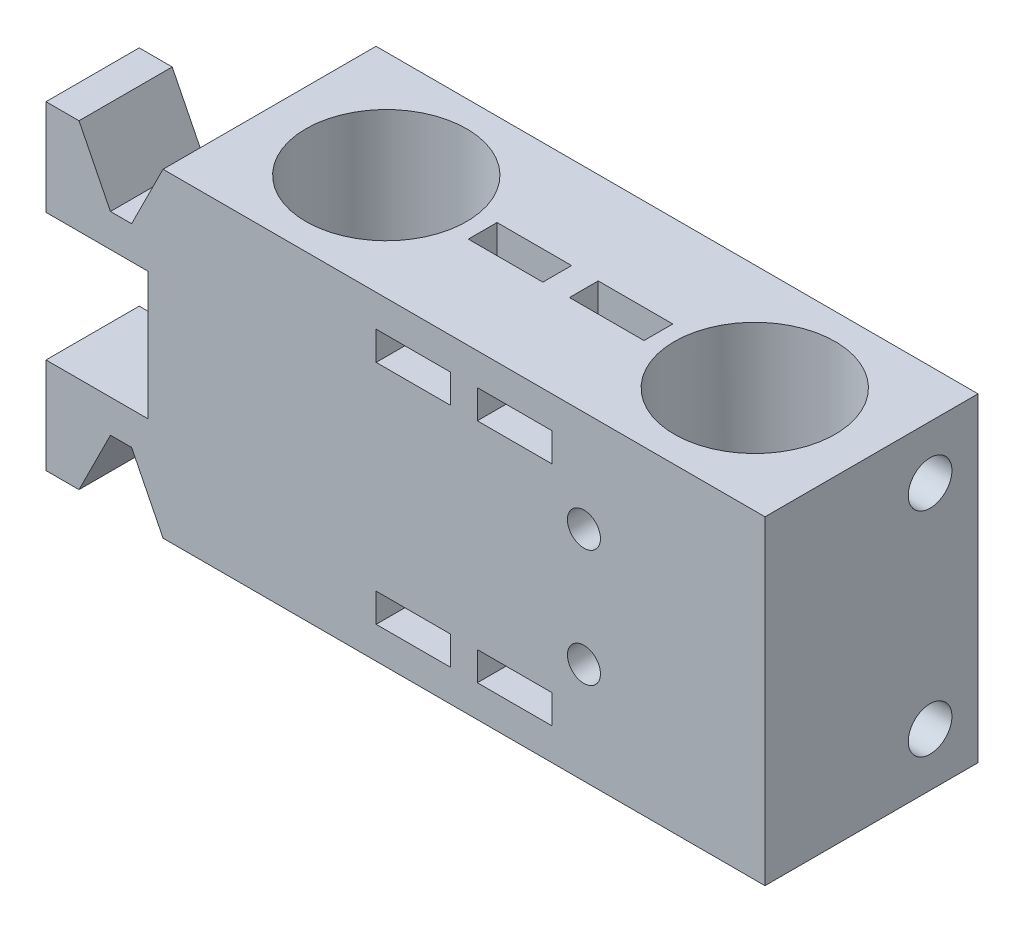
from build123d import *

# Parameters (mm, degrees)
BOSS_EXTRUDE1_DEPTH                     = 20
EARKNOTCH_SKETCH2_W                     = 10.99
EARKNOTCH_SKETCH2_H                     = 30
EARKNOTCH_CUT_EXTRUDE1_DEPTH            = 11.25
TOPHOLES_SKETCH3_R                      = 2.05
TOPHOLES_CUT_EXTRUDE2_DEPTH             = 4
FRONTHOLES_SKETCH1_R                    = 2.05
FRONTHOLES_CUT_EXTRUDE1_DEPTH           = 7
REARRIBBONHOLES_SKETCH2_W               = 7
REARRIBBONHOLES_SKETCH2_H               = 2.7
REARRIBBONHOLES_CUT_EXTRUDE1_DEPTH      = 11.35
RIGHTRIBBONHOLES_SKETCH4_W              = 7
RIGHTRIBBONHOLES_SKETCH4_H              = 2.7
RIGHTRIBBONHOLES_CUT_EXTRUDE2_DEPTH     = 5.7
LEFTRIBBONHOLES_SKETCH3_W               = 7
LEFTRIBBONHOLES_SKETCH3_H               = 2.7
LEFTRIBBONHOLES_CUT_EXTRUDE2_DEPTH      = 5.7
BOTTOMCLAMPMOUNTINGHOLESSKETCH3_R       = 2.05
BOTTOMCLAMPMOUNTHOLESCUT_EXTRUDE1_DEPTH = 4
LM8UUHOLESSKETCH1_R                     = 7.55
LM8UUCUT_EXTRUDE1_DEPTH                 = 77.534959986
RIBBONHOLEFILLET2_R                     = 2.7
RIBBONHOLEFILLET1_R                     = 2.7
RIBBONHOLEFILLET3_R                     = 2.7
RIBBONHOLEFILLET4_R                     = 2.7
PROBEMOUNTINGHOLESSKETCH1_R             = 1.55
PROBEMOUNTINGHOLESCUT_EXTRUDE1_DEPTH    = 3.1
LM8UUFASTENINGHOLESKETCH1_R             = 2.1
LM8UUFASTENINGHOLECUT_EXTRUDE1_DEPTH    = 14


with BuildPart() as part:
    # BackFace-Sketch1 → Boss-Extrude1 (new body)
    with BuildSketch(Plane.XY):
        Polygon((0, 0), (0, 9), (9.6, 9), (9.6, 21), (0, 21), (0, 30), (3.1, 30), (6.05, 24.095975949), (8.04, 24.095975949), (10.99, 30), (67.51, 30), (67.51, 0), (10.99, 0), (8.04, 5.904024051), (6.05, 5.904024051), (3.1, 0), align=None)
    extrude(amount=BOSS_EXTRUDE1_DEPTH)

    # EarKnotch-Sketch2 → EarKnotch-Cut-Extrude1 (cut)
    with BuildSketch(Plane(origin=(0, 0, 0), x_dir=(-1, 0, 0), z_dir=(0, 0, -1))):
        with Locations((-5.495, 15)):
            Rectangle(EARKNOTCH_SKETCH2_W, EARKNOTCH_SKETCH2_H)
    extrude(amount=-EARKNOTCH_CUT_EXTRUDE1_DEPTH, mode=Mode.SUBTRACT)

    # TopHoles-Sketch3 → TopHoles-Cut-Extrude2 (cut)
    with BuildSketch(Plane.ZY):
        with Locations((15.5, 25.5)):
            Circle(TOPHOLES_SKETCH3_R)
        with Locations((15.5, 4.5)):
            Circle(TOPHOLES_SKETCH3_R)
    extrude(amount=-TOPHOLES_CUT_EXTRUDE2_DEPTH, mode=Mode.SUBTRACT)

    # FrontHoles-Sketch1 → FrontHoles-Cut-Extrude1 (cut)
    with BuildSketch(Plane(origin=(0, 0, 0), x_dir=(-1, 0, 0), z_dir=(0, 0, -1))):
        with Locations((-43.86, 25)):
            Circle(FRONTHOLES_SKETCH1_R)
        with Locations((-43.86, 5)):
            Circle(FRONTHOLES_SKETCH1_R)
        with Locations((-31.86, 25)):
            Circle(FRONTHOLES_SKETCH1_R)
        with Locations((-31.86, 5)):
            Circle(FRONTHOLES_SKETCH1_R)
    extrude(amount=-FRONTHOLES_CUT_EXTRUDE1_DEPTH, mode=Mode.SUBTRACT)

    # RearRibbonHoles-Sketch2 → RearRibbonHoles-Cut-Extrude1 (cut)
    with BuildSketch(Plane.XY.offset(20)):
        with Locations((34.5, 25.65)):
            Rectangle(REARRIBBONHOLES_SKETCH2_W, REARRIBBONHOLES_SKETCH2_H)
        with Locations((44, 25.65)):
            Rectangle(REARRIBBONHOLES_SKETCH2_W, REARRIBBONHOLES_SKETCH2_H)
        with Locations((34.5, 4.35)):
            Rectangle(REARRIBBONHOLES_SKETCH2_W, REARRIBBONHOLES_SKETCH2_H)
        with Locations((44, 4.35)):
            Rectangle(REARRIBBONHOLES_SKETCH2_W, REARRIBBONHOLES_SKETCH2_H)
    extrude(amount=-REARRIBBONHOLES_CUT_EXTRUDE1_DEPTH, mode=Mode.SUBTRACT)

    # RightRibbonHoles-Sketch4 → RightRibbonHoles-Cut-Extrude2 (cut)
    with BuildSketch(Plane(origin=(0, 30, 0), x_dir=(1, 0, 0), z_dir=(0, 1, 0))):
        with Locations((34.5, -10)):
            Rectangle(RIGHTRIBBONHOLES_SKETCH4_W, RIGHTRIBBONHOLES_SKETCH4_H)
        with Locations((44, -10)):
            Rectangle(RIGHTRIBBONHOLES_SKETCH4_W, RIGHTRIBBONHOLES_SKETCH4_H)
    extrude(amount=-RIGHTRIBBONHOLES_CUT_EXTRUDE2_DEPTH, mode=Mode.SUBTRACT)

    # LeftRibbonHoles-Sketch3 → LeftRibbonHoles-Cut-Extrude2 (cut)
    with BuildSketch(Plane.XZ):
        with Locations((34.5, 10)):
            Rectangle(LEFTRIBBONHOLES_SKETCH3_W, LEFTRIBBONHOLES_SKETCH3_H)
        with Locations((44, 10)):
            Rectangle(LEFTRIBBONHOLES_SKETCH3_W, LEFTRIBBONHOLES_SKETCH3_H)
    extrude(amount=-LEFTRIBBONHOLES_CUT_EXTRUDE2_DEPTH, mode=Mode.SUBTRACT)

    # BottomClampMountingHolesSketch3 → BottomClampMountHolesCut-Extrude1 (cut)
    with BuildSketch(Plane(origin=(67.51, 0, 0), x_dir=(0, 0, -1), z_dir=(1, 0, 0))):
        with Locations((-4.5, 25)):
            Circle(BOTTOMCLAMPMOUNTINGHOLESSKETCH3_R)
        with Locations((-4.5, 5)):
            Circle(BOTTOMCLAMPMOUNTINGHOLESSKETCH3_R)
    extrude(amount=-BOTTOMCLAMPMOUNTHOLESCUT_EXTRUDE1_DEPTH, mode=Mode.SUBTRACT)

    # LM8UUHolesSketch1 → LM8UUCut-Extrude1 (cut, through all)
    with BuildSketch(Plane(origin=(0, 30, 0), x_dir=(1, 0, 0), z_dir=(0, 1, 0))):
        with Locations((21.95, -10)):
            Circle(LM8UUHOLESSKETCH1_R)
        with Locations((56.55, -10)):
            Circle(LM8UUHOLESSKETCH1_R)
    extrude(amount=-LM8UUCUT_EXTRUDE1_DEPTH, mode=Mode.SUBTRACT)

    # RibbonHoleFillet2
    ribbonholefillet2_edges = [part.edges().sort_by_distance(p)[0] for p in [
        (34.5, 5.7, 8.65),
    ]]
    fillet(ribbonholefillet2_edges, radius=RIBBONHOLEFILLET2_R)

    # RibbonHoleFillet1
    ribbonholefillet1_edges = [part.edges().sort_by_distance(p)[0] for p in [
        (44, 5.7, 8.65),
    ]]
    fillet(ribbonholefillet1_edges, radius=RIBBONHOLEFILLET1_R)

    # RibbonHoleFillet3
    ribbonholefillet3_edges = [part.edges().sort_by_distance(p)[0] for p in [
        (44, 24.3, 8.65),
    ]]
    fillet(ribbonholefillet3_edges, radius=RIBBONHOLEFILLET3_R)

    # RibbonHoleFillet4
    ribbonholefillet4_edges = [part.edges().sort_by_distance(p)[0] for p in [
        (34.5, 24.3, 8.65),
    ]]
    fillet(ribbonholefillet4_edges, radius=RIBBONHOLEFILLET4_R)

    # ProbeMountingHolesSketch1 → ProbeMountingHolesCut-Extrude1 (cut)
    with BuildSketch(Plane.XY.offset(20)):
        with Locations((50.51, 20.5)):
            Circle(PROBEMOUNTINGHOLESSKETCH1_R)
        with Locations((50.51, 9.5)):
            Circle(PROBEMOUNTINGHOLESSKETCH1_R)
    extrude(amount=-PROBEMOUNTINGHOLESCUT_EXTRUDE1_DEPTH, mode=Mode.SUBTRACT)

    # LM8UUFasteningHoleSketch1 → LM8UUFasteningHoleCut-Extrude1 (cut)
    with BuildSketch(Plane(origin=(0, 0, 0), x_dir=(-1, 0, 0), z_dir=(0, 0, -1))):
        with Locations((-30.55, 15)):
            Circle(LM8UUFASTENINGHOLESKETCH1_R)
        with Locations((-47.95, 15)):
            Circle(LM8UUFASTENINGHOLESKETCH1_R)
    extrude(amount=-LM8UUFASTENINGHOLECUT_EXTRUDE1_DEPTH, mode=Mode.SUBTRACT)


solid = part.part
